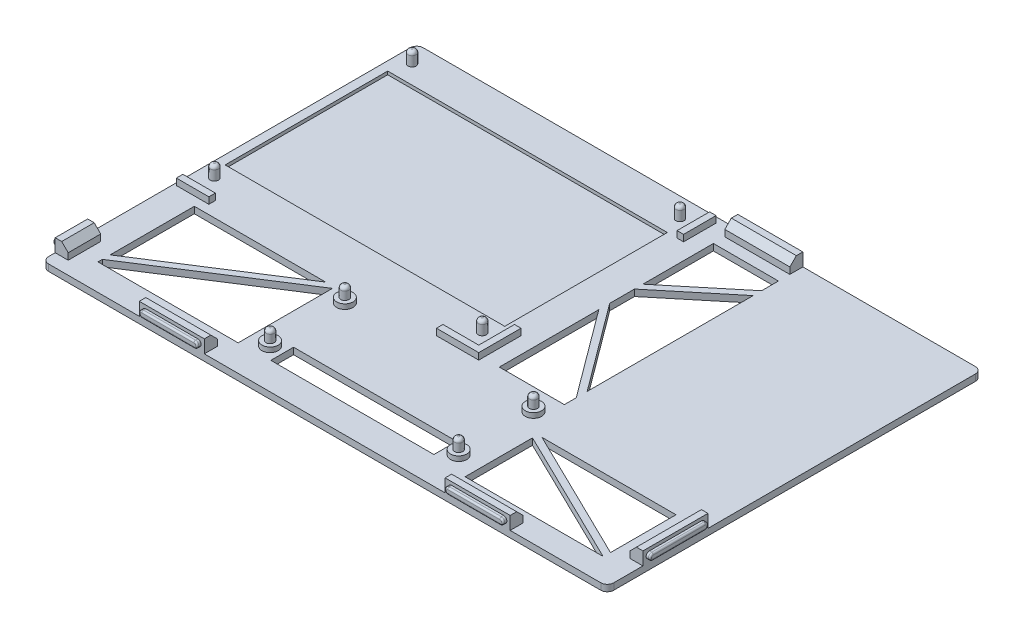
from build123d import *

# Parameters (mm, degrees)
SKETCH_1_W          = 173.8
SKETCH_1_H          = 115.2
EXTRUDE_1_DEPTH     = 2
SKETCH_3_W          = 2
SKETCH_3_H          = 10
SKETCH_3_W_2        = 10
SKETCH_3_H_2        = 2
EXTRUDE_2_DEPTH     = 2
SKETCH_4_R          = 1.25
EXTRUDE_3_DEPTH     = 4
FILLET_2_R          = 1
SKETCH_5_W          = 86
SKETCH_5_H          = 50
CUT_EXTRUDE_1_DEPTH = 1
SKETCH_8_R          = 2.5
EXTRUDE_4_DEPTH     = 1.5
SKETCH_8_3_R        = 1.25
EXTRUDE_5_DEPTH     = 5
FILLET_3_R          = 1
SKETCH_9_W          = 50.159646102
SKETCH_9_H          = 7
CUT_EXTRUDE_2_DEPTH = 2
SKETCH_10_W         = 20
SKETCH_10_H         = 4
SKETCH_10_W_2       = 4
SKETCH_10_H_2       = 20
SKETCH_10_H_3       = 10
EXTRUDE_6_DEPTH     = 4
CUT_EXTRUDE_3_DEPTH = 105.376098797
FILLET_1_R          = 2
CHAMFER_1_SIZE      = 2
EXTRUDE_8_DEPTH     = 1.2
EXTRUDE_9_DEPTH     = 1.2
EXTRUDE_11_DEPTH    = 1.2
EXTRUDE_12_DEPTH    = 1.2
FILLET_4_R          = 0.5


with BuildPart() as part:
    # 草圖1 → 填料-伸長1 (new body)
    with BuildSketch(Plane(origin=(0, 0, 0), x_dir=(1, 0, 0), z_dir=(0, 1, 0))):
        Rectangle(SKETCH_1_W, SKETCH_1_H)
    extrude(amount=EXTRUDE_1_DEPTH)

    # 草圖3 → 填料-伸長2 (add)
    with BuildSketch(Plane(origin=(0, 2, 0), x_dir=(1, 0, 0), z_dir=(0, 1, 0))):
        with Locations((5.84, 50.93)):
            Rectangle(SKETCH_3_W, SKETCH_3_H)
        Polygon((4.84, -14.07), (4.84, -4.07), (6.84, -4.07), (6.84, -14.07), (6.84, -15.07), (6.84, -17.07), (-6.16, -17.07), (-6.16, -15.07), (4.84, -15.07), align=None)
        with Locations((-81.16, -16.07)):
            Rectangle(SKETCH_3_W_2, SKETCH_3_H_2)
    extrude(amount=EXTRUDE_2_DEPTH)

    # 草圖4 → 填料-伸長3 (add)
    with BuildSketch(Plane(origin=(0, 2, 0), x_dir=(1, 0, 0), z_dir=(0, 1, 0))):
        with Locations((0.04, 51.63)):
            Circle(SKETCH_4_R)
        with Locations((0.04, -9.17)):
            Circle(SKETCH_4_R)
        with Locations((-82.36, -9.17)):
            Circle(SKETCH_4_R)
        with Locations((-82.36, 51.63)):
            Circle(SKETCH_4_R)
    extrude(amount=EXTRUDE_3_DEPTH)

    # 圓角2
    fillet_2_edges = [part.edges().sort_by_distance(p)[0] for p in [
        (-83.61, 6, -51.63),
        (-83.61, 6, 9.17),
        (-1.21, 6, 9.17),
        (-1.21, 6, -51.63),
    ]]
    fillet(fillet_2_edges, radius=FILLET_2_R)

    # 草圖5 → 除料-伸長1 (cut)
    with BuildSketch(Plane(origin=(0, 2, 0), x_dir=(1, 0, 0), z_dir=(0, 1, 0))):
        with Locations((-41.16, 20.93)):
            Rectangle(SKETCH_5_W, SKETCH_5_H)
    extrude(amount=-CUT_EXTRUDE_1_DEPTH, mode=Mode.SUBTRACT)

    # 草圖8 → 填料-伸長4 (add)
    with BuildSketch(Plane(origin=(0, 2, 0), x_dir=(1, 0, 0), z_dir=(0, 1, 0))):
        with Locations((29, -22.4)):
            Circle(SKETCH_8_R)
        with Locations((29, -45.4)):
            Circle(SKETCH_8_R)
        with Locations((-29, -45.4)):
            Circle(SKETCH_8_R)
        with Locations((-29, -22.4)):
            Circle(SKETCH_8_R)
    extrude(amount=EXTRUDE_4_DEPTH)

    # 草圖8<3> → 填料-伸長5 (add)
    with BuildSketch(Plane(origin=(0, 2, 0), x_dir=(1, 0, 0), z_dir=(0, 1, 0))):
        with Locations((29, -22.4)):
            Circle(SKETCH_8_3_R)
        with Locations((29, -45.4)):
            Circle(SKETCH_8_3_R)
        with Locations((-29, -45.4)):
            Circle(SKETCH_8_3_R)
        with Locations((-29, -22.4)):
            Circle(SKETCH_8_3_R)
    extrude(amount=EXTRUDE_5_DEPTH)

    # 圓角3
    fillet_3_edges = [part.edges().sort_by_distance(p)[0] for p in [
        (-30.25, 7, 45.4),
        (27.75, 7, 45.4),
        (27.75, 7, 22.4),
        (-30.25, 7, 22.4),
    ]]
    fillet(fillet_3_edges, radius=FILLET_3_R)

    # 草圖9 → 除料-伸長2 (cut)
    with BuildSketch(Plane(origin=(0, 2, 0), x_dir=(1, 0, 0), z_dir=(0, 1, 0))):
        with Locations((0, -45.6)):
            Rectangle(SKETCH_9_W, SKETCH_9_H)
    extrude(amount=-CUT_EXTRUDE_2_DEPTH, mode=Mode.SUBTRACT)

    # 草圖10 → 填料-伸長6 (add)
    with BuildSketch(Plane(origin=(0, 2, 0), x_dir=(1, 0, 0), z_dir=(0, 1, 0))):
        with Locations((21.854715439, 55.6)):
            Rectangle(SKETCH_10_W, SKETCH_10_H)
        with Locations((84.9, -36.637998684)):
            Rectangle(SKETCH_10_W_2, SKETCH_10_H_2)
        with Locations((47.031889085, -55.6)):
            Rectangle(SKETCH_10_W, SKETCH_10_H)
        with Locations((-47.031889085, -55.6)):
            Rectangle(SKETCH_10_W, SKETCH_10_H)
        with Locations((-84.9, -48.6)):
            Rectangle(SKETCH_10_W_2, SKETCH_10_H_3)
    extrude(amount=EXTRUDE_6_DEPTH)

    # 草圖11 → 除料-伸長3 (cut, through all)
    with BuildSketch(Plane(origin=(0, 2, 0), x_dir=(1, 0, 0), z_dir=(0, 1, 0))):
        Polygon((-77.879578173, -45.722583606), (-37.497069547, -19.823892626), (-77.879578173, -19.823892626), align=None)
        Polygon((-77.879578173, -49.467196386), (-34.764514275, -49.467196386), (-34.764514275, -20.447382192), (-77.879578173, -48.098554803), align=None)
        Polygon((31.854715439, 44.917489498), (11.854715439, 28.410289152), (11.854715439, 50.090728689), (31.854715439, 50.090728689), align=None)
        Polygon((11.854715439, -15.752914676), (31.854715439, -15.752914676), (31.854715439, -12.091582027), (11.854715439, 14.843632999), align=None)
        Polygon((11.854715439, 25.817052443), (31.854715439, 42.324252788), (31.854715439, -8.736726131), (11.854715439, 18.198488896), align=None)
        Polygon((78.359380095, -48.062791021), (37.115806701, -27.915068386), (78.359380095, -27.915068386), align=None)
        Polygon((35.80419089, -29.5002187), (35.80419089, -50.229107424), (78.237445455, -50.229107424), align=None)
    extrude(amount=-CUT_EXTRUDE_3_DEPTH, mode=Mode.SUBTRACT)

    # 圓角1
    fillet_1_edges = [part.edges().sort_by_distance(p)[0] for p in [
        (86.9, 1, -57.6),
        (-86.9, 1, -57.6),
        (-86.9, 1, 57.6),
        (86.9, 1, 57.6),
    ]]
    fillet(fillet_1_edges, radius=FILLET_1_R)

    # 導角1
    chamfer_1_edges = [part.edges().sort_by_distance(p)[0] for p in [
        (82.9, 6, 36.637998684),
        (47.031889085, 6, 53.6),
        (-47.031889085, 6, 53.6),
        (-82.9, 6, 48.6),
        (21.854715439, 6, -53.6),
    ]]
    chamfer(chamfer_1_edges, length=CHAMFER_1_SIZE)

    # 草圖13 → 填料-伸長8 (add)
    with BuildSketch(Plane(origin=(86.9, 0, 0), x_dir=(0, 0, -1), z_dir=(1, 0, 0))):
        with BuildLine():
            Line((-44.637998684, 5), (-28.637998684, 5))
            ThreePointArc((-28.637998684, 5), (-27.637998684, 4), (-28.637998684, 3))
            Line((-28.637998684, 3), (-44.637998684, 3))
            ThreePointArc((-44.637998684, 3), (-45.637998684, 4), (-44.637998684, 5))
        make_face()
    extrude(amount=EXTRUDE_8_DEPTH)

    # 草圖14 → 填料-伸長9 (add)
    with BuildSketch(Plane(origin=(0, 0, -57.6), x_dir=(-1, 0, 0), z_dir=(0, 0, -1))):
        with BuildLine():
            Line((-29.854715439, 5), (-13.854715439, 5))
            ThreePointArc((-13.854715439, 5), (-12.854715439, 4), (-13.854715439, 3))
            Line((-13.854715439, 3), (-29.854715439, 3))
            ThreePointArc((-29.854715439, 3), (-30.854715439, 4), (-29.854715439, 5))
        make_face()
    extrude(amount=EXTRUDE_9_DEPTH)

    # 草圖15 → 填料-伸長11 (add)
    with BuildSketch(Plane.XY.offset(57.6)):
        with BuildLine():
            Line((-55.031889085, 5), (-39.031889085, 5))
            ThreePointArc((-39.031889085, 5), (-38.031889085, 4), (-39.031889085, 3))
            Line((-39.031889085, 3), (-55.031889085, 3))
            ThreePointArc((-55.031889085, 3), (-56.031889085, 4), (-55.031889085, 5))
        make_face()
        with BuildLine():
            Line((55.031889085, 5), (39.031889085, 5))
            ThreePointArc((39.031889085, 5), (38.031889085, 4), (39.031889085, 3))
            Line((39.031889085, 3), (55.031889085, 3))
            ThreePointArc((55.031889085, 3), (56.031889085, 4), (55.031889085, 5))
        make_face()
    extrude(amount=EXTRUDE_11_DEPTH)

    # 草圖16 → 填料-伸長12 (add)
    with BuildSketch(Plane.ZY.offset(86.9)):
        with BuildLine():
            Line((45.1, 5), (52.1, 5))
            ThreePointArc((52.1, 5), (53.1, 4), (52.1, 3))
            Line((52.1, 3), (45.1, 3))
            ThreePointArc((45.1, 3), (44.1, 4), (45.1, 5))
        make_face()
    extrude(amount=EXTRUDE_12_DEPTH)

    # 圓角4
    fillet_4_edges = [part.edges().sort_by_distance(p)[0] for p in [
        (12.854715439, 4, -58.8),
        (21.854715439, 3, -58.8),
        (30.854715439, 4, -58.8),
        (88.1, 4, 27.637998684),
        (88.1, 3, 36.637998684),
        (88.1, 4, 45.637998684),
        (56.031889085, 4, 58.8),
        (47.031889085, 3, 58.8),
        (38.031889085, 4, 58.8),
        (-88.1, 4, 53.1),
        (-88.1, 3, 48.6),
        (-88.1, 4, 44.1),
        (-38.031889085, 4, 58.8),
        (-47.031889085, 3, 58.8),
        (-56.031889085, 4, 58.8),
        (21.854715439, 5, -58.8),
        (88.1, 5, 36.637998684),
        (47.031889085, 5, 58.8),
        (-88.1, 5, 48.6),
        (-47.031889085, 5, 58.8),
    ]]
    fillet(fillet_4_edges, radius=FILLET_4_R)


solid = part.part
